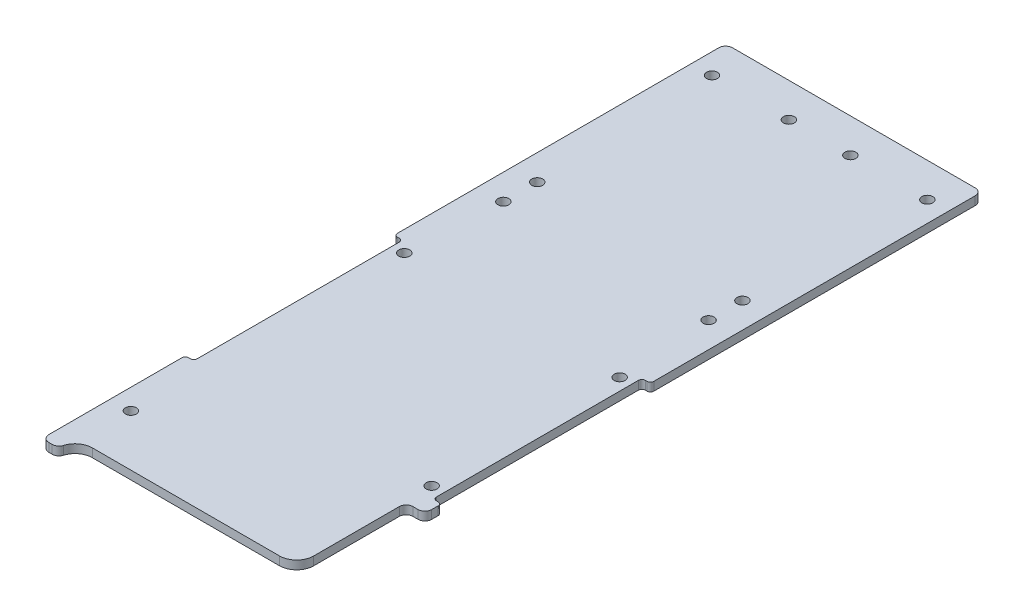
from build123d import *

# Parameters (mm, degrees)
SKETCH1_R               = 2.032
BOSS_EXTRUDE1_DEPTH     = 3.175
FILLET1_R               = 2.54
FILLET2_R               = 2.54
FILLET3_R               = 6.35
CUT_EXTRUDE1_DEPTH      = 136.673215063
FILLET4_R               = 6.35
FILLET5_R               = 2.54
SKETCH3_R               = 2.032
CUT_EXTRUDE2_DEPTH      = 136.673215063
CUT_EXTRUDE3_DEPTH      = 136.673215063
CUT_EXTRUDE3_DEPTH_BACK = 136.673215063
SKETCH4_W               = 3.17499648
SKETCH4_H               = 77.591915629
SKETCH4_W_2             = 3.17500352
FILLET6_R               = 1.27


with BuildPart() as part:
    # Sketch1 → Boss-Extrude1 (new body)
    with BuildSketch(Plane(origin=(0, 0, 0), x_dir=(1, 0, 0), z_dir=(0, 1, 0))):
        Polygon((47.625, 127), (-47.625, 127), (-47.625, -127), (-41.275, -127), (-41.275, -120.65), (41.275, -120.65), (41.275, -127), (47.625, -127), align=None)
        with Locations((-39.999684148, -101.6)):
            Circle(SKETCH1_R, mode=Mode.SUBTRACT)
        with Locations((39.999684148, -69.85)):
            Circle(SKETCH1_R, mode=Mode.SUBTRACT)
        with Locations((-39.999684148, 0)):
            Circle(SKETCH1_R, mode=Mode.SUBTRACT)
        with Locations((-39.999684148, 114.3)):
            Circle(SKETCH1_R, mode=Mode.SUBTRACT)
        with Locations((-11.424684148, 114.3)):
            Circle(SKETCH1_R, mode=Mode.SUBTRACT)
        with Locations((39.999684148, 0)):
            Circle(SKETCH1_R, mode=Mode.SUBTRACT)
        with Locations((11.424684148, 114.3)):
            Circle(SKETCH1_R, mode=Mode.SUBTRACT)
        with Locations((39.999684148, 114.3)):
            Circle(SKETCH1_R, mode=Mode.SUBTRACT)
    extrude(amount=BOSS_EXTRUDE1_DEPTH)

    # Fillet1
    fillet1_edges = [part.edges().sort_by_distance(p)[0] for p in [
        (-47.625, 1.5875, -127),
        (47.625, 1.5875, -127),
        (47.625, 1.5875, 127),
        (-47.625, 1.5875, 127),
    ]]
    fillet(fillet1_edges, radius=FILLET1_R)

    # Fillet2
    fillet2_edges = [part.edges().sort_by_distance(p)[0] for p in [
        (41.275, 1.5875, 127),
        (-41.275, 1.5875, 127),
    ]]
    fillet(fillet2_edges, radius=FILLET2_R)

    # Fillet3
    fillet3_edges = [part.edges().sort_by_distance(p)[0] for p in [
        (41.275, 1.5875, 120.65),
        (-41.275, 1.5875, 120.65),
    ]]
    fillet(fillet3_edges, radius=FILLET3_R)

    # Sketch2 → Cut-Extrude1 (cut, through all)
    with BuildSketch(Plane.XZ):
        with BuildLine():
            Line((47.625, 131.883089137), (41.911214098, 131.883089137))
            Line((41.911214098, 131.883089137), (41.911214098, 126.141427739))
            ThreePointArc((41.911214098, 126.141427739), (41.594030993, 125.69243526), (41.380880287, 125.185714286))
            ThreePointArc((41.380880287, 125.185714286), (41.067672944, 124.353218056), (40.641214098, 123.57265309))
            Line((40.641214098, 123.57265309), (40.641214098, 79.981419179))
            Line((40.641214098, 79.981419179), (47.625, 79.981419179))
            Line((47.625, 79.981419179), (47.625, 131.883089137))
        make_face()
    extrude(amount=-CUT_EXTRUDE1_DEPTH, mode=Mode.SUBTRACT)

    # Fillet4
    fillet4_edges = [part.edges().sort_by_distance(p)[0] for p in [
        (40.641214098, 1.5875, 123.57265309),
    ]]
    fillet(fillet4_edges, radius=FILLET4_R)

    # Fillet5
    fillet5_edges = [part.edges().sort_by_distance(p)[0] for p in [
        (47.625, 1.5875, 79.981419179),
        (40.641214098, 1.5875, 79.981419179),
    ]]
    fillet(fillet5_edges, radius=FILLET5_R)

    # Sketch3 → Cut-Extrude2 (cut, through all)
    with BuildSketch(Plane.XZ):
        with Locations((-38.112709327, -34.913768806)):
            Circle(SKETCH3_R)
        with Locations((-38.112709327, -47.490173279)):
            Circle(SKETCH3_R)
        with Locations((38.112709327, -47.490173279)):
            Circle(SKETCH3_R)
        with Locations((38.112709327, -34.913768806)):
            Circle(SKETCH3_R)
    extrude(amount=-CUT_EXTRUDE2_DEPTH, mode=Mode.SUBTRACT)

    # Sketch4 → Cut-Extrude3 (cut, two sides: drawn at the far end of the back side and taken through both)
    with BuildSketch(Plane(origin=(0, 3.175, 0), x_dir=(1, 0, 0), z_dir=(0, 1, 0)).offset(-CUT_EXTRUDE3_DEPTH_BACK)):
        with Locations((-46.03750176, -34.985947153)):
            Rectangle(SKETCH4_W, SKETCH4_H)
        with Locations((46.03749824, -34.985947153)):
            Rectangle(SKETCH4_W_2, SKETCH4_H)
    extrude(amount=CUT_EXTRUDE3_DEPTH + CUT_EXTRUDE3_DEPTH_BACK, mode=Mode.SUBTRACT)

    # Fillet6
    fillet6_edges = [part.edges().sort_by_distance(p)[0] for p in [
        (-44.45000352, 1.5875, -3.810010662),
        (-44.45000352, 1.5875, 73.781904967),
        (44.44999648, 1.5875, -3.810010662),
        (44.44999648, 1.5875, 73.781904967),
        (47.625, 1.5875, 73.781904967),
        (47.625, 1.5875, -3.810010662),
        (-47.625, 1.5875, 73.781904967),
        (-47.625, 1.5875, -3.810010662),
    ]]
    fillet(fillet6_edges, radius=FILLET6_R)


solid = part.part
